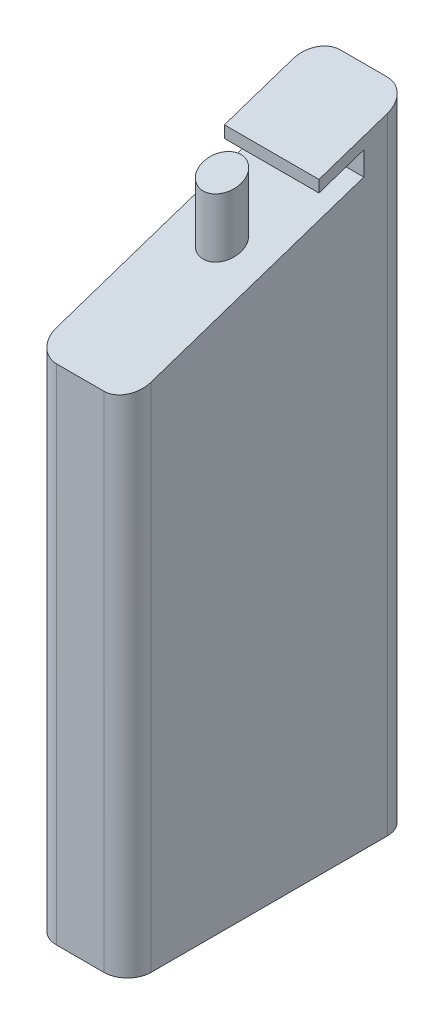
from build123d import *

# Parameters (mm, degrees)
SKETCH1_W               = 25.4
SKETCH1_H               = 76.2
BOSS_EXTRUDE1_DEPTH     = 160.782
CUT_EXTRUDE2_DEPTH      = 168.175421411
CUT_EXTRUDE2_DEPTH_BACK = 168.175421411
BOSS_EXTRUDE2_REACH     = 177.247
SKETCH1_5_W             = 25.4
SKETCH1_5_H             = 12.7
SKETCH8_W               = 25.4
SKETCH8_H               = 3.175
BOSS_EXTRUDE3_DEPTH     = 12.7
FILLET1_R               = 6.35
BOSS_EXTRUDE4_REACH     = 192.853
SKETCH9_R               = 5.08
SKETCH9_3_R             = 5.715
CUT_EXTRUDE5_DEPTH      = 15.875


with BuildPart() as part:
    # Sketch1 → Boss-Extrude1 (new body)
    with BuildSketch(Plane(origin=(0, 0, 0), x_dir=(1, 0, 0), z_dir=(0, 1, 0))):
        Rectangle(SKETCH1_W, SKETCH1_H)
    extrude(amount=BOSS_EXTRUDE1_DEPTH)

    # Sketch4 → Cut-Extrude2 (cut, two sides: drawn at the far end of the back side and taken through both)
    with BuildSketch(Plane(origin=(12.7, 0, 0), x_dir=(0, 0, -1), z_dir=(1, 0, 0)).offset(-CUT_EXTRUDE2_DEPTH_BACK)):
        Polygon((38.1, 160.782), (-38.1, 160.782), (-38.1, 135.285836654), align=None)
    extrude(amount=CUT_EXTRUDE2_DEPTH + CUT_EXTRUDE2_DEPTH_BACK, mode=Mode.SUBTRACT)

    # Boss-Extrude2: from a plane face, 177.247 long prism both ways, kept between that surface and its translate by the depth
    boss_extrude2_start = Plane(origin=(-12.7, 135.285836654, 38.1), z_dir=(0, -0.9483236552061991, -0.31730465640509276)) * Box(710.988, 710.988, 355.494, align=(Align.CENTER, Align.CENTER, Align.MIN), mode=Mode.PRIVATE)
    boss_extrude2_end = Plane(origin=(-12.7, 144.810836654, 38.1), z_dir=(0, -0.9483236552061991, -0.31730465640509276)) * Box(710.988, 710.988, 355.494, align=(Align.CENTER, Align.CENTER, Align.MIN), mode=Mode.PRIVATE)
    # Sketch1<5> → Boss-Extrude2 (add, from a surface)
    with BuildSketch(Plane(origin=(0, 0, 0), x_dir=(1, 0, 0), z_dir=(0, 1, 0)), mode=Mode.PRIVATE) as boss_extrude2_sk1:
        with Locations((0, 31.75)):
            Rectangle(SKETCH1_5_W, SKETCH1_5_H)
    boss_extrude2_tool1 = extrude(boss_extrude2_sk1.sketch, amount=BOSS_EXTRUDE2_REACH, both=True, mode=Mode.PRIVATE)
    add(((boss_extrude2_tool1 - boss_extrude2_start) & boss_extrude2_end).solids().sort_by_distance((-3.175, 151.220939, -9.525))[0])

    # Sketch8 → Boss-Extrude3 (add, along a direction that is not the sketch's normal)
    with BuildSketch(Plane.XY.offset(-25.4)):
        with Locations((0, 164.470139442)):
            Rectangle(SKETCH8_W, SKETCH8_H)
    extrude(amount=BOSS_EXTRUDE3_DEPTH, dir=(0, -0.31730465640509276, 0.9483236552061991))

    # Fillet1
    fillet1_edges = [part.edges().sort_by_distance(p)[0] for p in [
        (-12.7, 85.1535, -38.1),
        (12.7, 85.1535, -38.1),
        (-12.7, 67.642918327, 38.1),
        (12.7, 67.642918327, 38.1),
    ]]
    fillet(fillet1_edges, radius=FILLET1_R)

    # Boss-Extrude4: from a plane face, 192.853 long prism both ways, kept between that surface and its translate by the depth
    boss_extrude4_start = Plane(origin=(-12.7, 135.285836654, 38.1), z_dir=(0, -0.9483236552061991, -0.31730465640509276)) * Box(773.412, 773.412, 386.706, align=(Align.CENTER, Align.CENTER, Align.MIN), mode=Mode.PRIVATE)
    boss_extrude4_end = Plane(origin=(-12.7, 151.160836654, 38.1), z_dir=(0, -0.9483236552061991, -0.31730465640509276)) * Box(773.412, 773.412, 386.706, align=(Align.CENTER, Align.CENTER, Align.MIN), mode=Mode.PRIVATE)
    # Sketch9 → Boss-Extrude4 (add, from a surface)
    with BuildSketch(Plane.XZ, mode=Mode.PRIVATE) as boss_extrude4_sk1:
        Circle(SKETCH9_R)
    boss_extrude4_tool1 = extrude(boss_extrude4_sk1.sketch, amount=BOSS_EXTRUDE4_REACH, both=True, mode=Mode.PRIVATE)
    add(((boss_extrude4_tool1 - boss_extrude4_start) & boss_extrude4_end).solids().sort_by_distance((0, 144.523163, 10.492543))[0])

    # Sketch9<3> → Cut-Extrude5 (cut)
    with BuildSketch(Plane.XZ):
        Circle(SKETCH9_3_R)
    extrude(amount=-CUT_EXTRUDE5_DEPTH, mode=Mode.SUBTRACT)


solid = part.part
